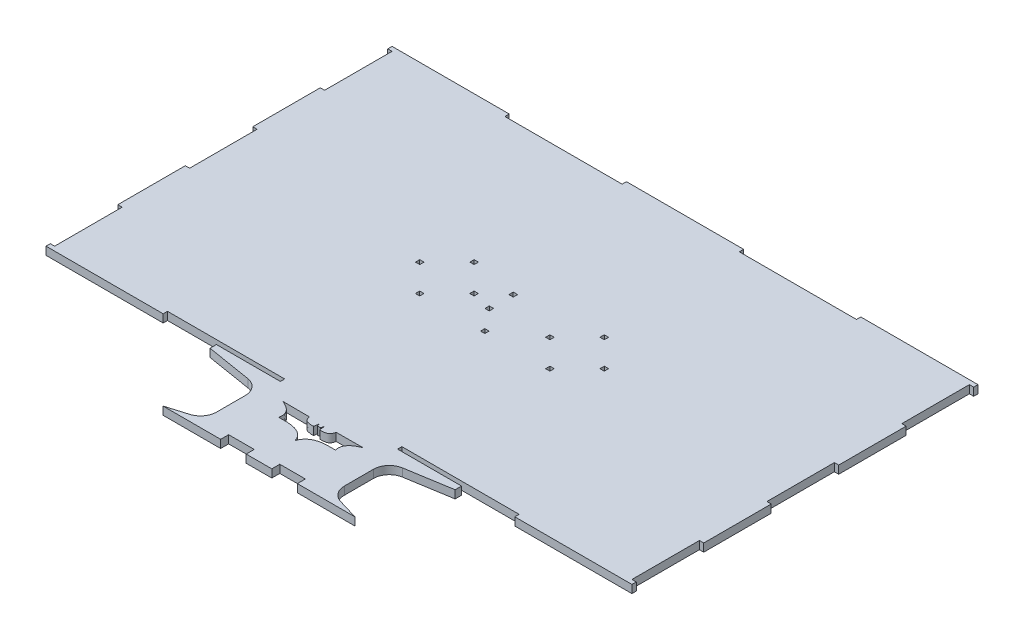
from build123d import *

# Parameters (mm, degrees)
SKETCH1_W           = 2.7
SKETCH1_H           = 2.7
BOSS_EXTRUDE1_DEPTH = 5


with BuildPart() as part:
    # Sketch1 → Boss-Extrude1 (new body)
    with BuildSketch(Plane(origin=(0, 0, 0), x_dir=(1, 0, 0), z_dir=(0, 1, 0))):
        with BuildLine():
            Line((-183.2, 108.2), (-109.92, 108.2))
            Line((-109.92, 108.2), (-109.92, 105.5))
            Line((-109.92, 105.5), (-36.64, 105.5))
            Line((-36.64, 105.5), (-36.64, 108.2))
            Line((-36.64, 108.2), (36.64, 108.2))
            Line((36.64, 108.2), (36.64, 105.5))
            Line((36.64, 105.5), (109.92, 105.5))
            Line((109.92, 105.5), (109.92, 108.2))
            Line((109.92, 108.2), (183.2, 108.2))
            Line((183.2, 108.2), (183.2, 105.5))
            Line((183.2, 105.5), (180.5, 105.5))
            Line((180.5, 105.5), (180.5, 63.3))
            Line((180.5, 63.3), (183.2, 63.3))
            Line((183.2, 63.3), (183.2, 21.1))
            Line((183.2, 21.1), (180.5, 21.1))
            Line((180.5, 21.1), (180.5, -21.1))
            Line((180.5, -21.1), (183.2, -21.1))
            Line((183.2, -21.1), (183.2, -63.3))
            Line((183.2, -63.3), (180.5, -63.3))
            Line((180.5, -63.3), (180.5, -105.5))
            Line((180.5, -105.5), (183.2, -105.5))
            Line((183.2, -105.5), (183.2, -108.2))
            Line((183.2, -108.2), (109.92, -108.2))
            Line((109.92, -108.2), (109.92, -105.5))
            Line((109.92, -105.5), (36.64, -105.5))
            Line((36.64, -105.5), (36.64, -108.2))
            Line((36.64, -108.2), (76.64, -108.2))
            Line((76.64, -108.2), (76.64, -112.2))
            Line((76.64, -112.2), (48.383969685, -116.8270792))
            ThreePointArc((48.383969685, -116.8270792), (42.378966502, -120.22108374), (40, -126.695637657))
            Line((40, -126.695637657), (40, -144.759693491))
            ThreePointArc((40, -144.759693491), (41.977070717, -150.728998787), (47.126521144, -154.337956343))
            Line((47.126521144, -154.337956343), (60, -158.2))
            Line((60, -158.2), (40, -158.2))
            Line((40, -158.2), (24, -158.2))
            Line((24, -158.2), (24, -153.2))
            Line((24, -153.2), (8, -153.2))
            Line((8, -153.2), (8, -158.2))
            Line((8, -158.2), (-8, -158.2))
            Line((-8, -158.2), (-8, -153.2))
            Line((-8, -153.2), (-24, -153.2))
            Line((-24, -153.2), (-24, -158.2))
            Line((-24, -158.2), (-40, -158.2))
            Line((-40, -158.2), (-60, -158.2))
            Line((-60, -158.2), (-47.126521144, -154.337956343))
            ThreePointArc((-47.126521144, -154.337956343), (-41.977070717, -150.728998787), (-40, -144.759693491))
            Line((-40, -144.759693491), (-40, -126.695637657))
            ThreePointArc((-40, -126.695637657), (-42.378966502, -120.22108374), (-48.383969685, -116.8270792))
            Line((-48.383969685, -116.8270792), (-76.64, -112.2))
            Line((-76.64, -112.2), (-76.64, -108.2))
            Line((-76.64, -108.2), (-36.64, -108.2))
            Line((-36.64, -108.2), (-36.64, -105.5))
            Line((-36.64, -105.5), (-109.92, -105.5))
            Line((-109.92, -105.5), (-109.92, -108.2))
            Line((-109.92, -108.2), (-183.2, -108.2))
            Line((-183.2, -108.2), (-183.2, -105.5))
            Line((-183.2, -105.5), (-180.5, -105.5))
            Line((-180.5, -105.5), (-180.5, -63.3))
            Line((-180.5, -63.3), (-183.2, -63.3))
            Line((-183.2, -63.3), (-183.2, -21.1))
            Line((-183.2, -21.1), (-180.5, -21.1))
            Line((-180.5, -21.1), (-180.5, 21.1))
            Line((-180.5, 21.1), (-183.2, 21.1))
            Line((-183.2, 21.1), (-183.2, 63.3))
            Line((-183.2, 63.3), (-180.5, 63.3))
            Line((-180.5, 63.3), (-180.5, 105.5))
            Line((-180.5, 105.5), (-183.2, 105.5))
            Line((-183.2, 105.5), (-183.2, 108.2))
        make_face()
        with BuildLine():
            Line((0.9301176, -120.716600974), (0, -120.68082722))
            Line((0, -120.68082722), (-0.9301176, -120.716600974))
            Line((-0.9301176, -120.716600974), (-1.4468496, -118.933875574))
            Line((-1.4468496, -118.933875574), (-1.505337966, -118.732090711))
            Line((-1.505337966, -118.732090711), (-1.5243594, -118.908038974))
            add(Edge.make_bspline(
                [(-2.0927646, -122.111777374), (-2.0066426, -121.999818774), (-1.859073837, -121.914980184), (-1.8343986, -121.775901574), (-1.666428749, -120.829162413), (-1.6277058, -119.863993174), (-1.5243594, -118.908038974)],
                knots=[0, 0, 0, 0, 1, 1, 1, 2, 2, 2, 2], degree=3))
            add(Edge.make_bspline(
                [(-8.3452218, -118.287960574), (-8.1729778, -118.856365774), (-8.075779611, -119.453175974), (-7.8284898, -119.993176174), (-7.648412968, -120.386405174), (-7.396003023, -120.758010223), (-7.0792284, -121.052476774), (-6.770919603, -121.339073684), (-6.396966748, -121.576394249), (-5.9940912, -121.698391774), (-5.156587311, -121.952002107), (-4.280620327, -122.071245104), (-3.4104312, -122.163450574), (-2.973318406, -122.209767162), (-2.5319868, -122.129001774), (-2.0927646, -122.111777374)],
                knots=[0, 0, 0, 0, 1, 1, 1, 2, 2, 2, 3, 3, 3, 4, 4, 4, 5, 5, 5, 5], degree=3))
            Line((-8.3452218, -118.287960574), (-25.0098288, -118.210450774))
            add(Edge.make_bspline(
                [(-17.7239076, -128.157541774), (-17.6463978, -127.503014574), (-17.486801223, -126.8530449), (-17.4913782, -126.193960174), (-17.495488714, -125.602046218), (-17.572706856, -125.001904806), (-17.7497442, -124.437071374), (-17.938674268, -123.834294492), (-18.223243755, -123.255529036), (-18.5765154, -122.731855774), (-18.962093872, -122.160292392), (-19.432781213, -121.642214377), (-19.9458552, -121.181659774), (-20.53296266, -120.654649929), (-21.178318096, -120.187467606), (-21.8577636, -119.786483374), (-22.869428608, -119.189435173), (-23.975534695, -118.767378369), (-25.0098288, -118.210450774)],
                knots=[0, 0, 0, 0, 1, 1, 1, 2, 2, 2, 3, 3, 3, 4, 4, 4, 5, 5, 5, 6, 6, 6, 6], degree=3))
            add(Edge.make_bspline(
                [(0, -135.727665574), (-0.258366, -135.081750574), (-0.446586906, -134.403141283), (-0.775098, -133.789920574), (-1.096611928, -133.189761242), (-1.489704454, -132.623203353), (-1.937745, -132.110541574), (-2.391023881, -131.591885932), (-2.905578598, -131.121252413), (-3.4621044, -130.715365174), (-4.057630696, -130.281033966), (-4.699347279, -129.901244204), (-5.3740128, -129.604391374), (-6.21408481, -129.23475969), (-7.091056719, -128.940135618), (-7.9835094, -128.725946974), (-9.035354612, -128.473504123), (-10.109700417, -128.304069497), (-11.1872478, -128.209214974), (-12.58604985, -128.086080991), (-13.995132408, -128.060594987), (-15.3986136, -128.105868574), (-16.173499897, -128.130864906), (-16.9488096, -128.140317374), (-17.7239076, -128.157541774)],
                knots=[0, 0, 0, 0, 1, 1, 1, 2, 2, 2, 3, 3, 3, 4, 4, 4, 5, 5, 5, 6, 6, 6, 7, 7, 7, 8, 8, 8, 8], degree=3))
            add(Edge.make_bspline(
                [(0, -135.727665574), (0.258366, -135.081750574), (0.446586906, -134.403141283), (0.775098, -133.789920574), (1.096611928, -133.189761242), (1.489704454, -132.623203353), (1.937745, -132.110541574), (2.391023881, -131.591885932), (2.905578598, -131.121252413), (3.4621044, -130.715365174), (4.057630696, -130.281033966), (4.699347279, -129.901244204), (5.3740128, -129.604391374), (6.21408481, -129.23475969), (7.091056719, -128.940135618), (7.9835094, -128.725946974), (9.035354612, -128.473504123), (10.109700417, -128.304069497), (11.1872478, -128.209214974), (12.58604985, -128.086080991), (13.995132408, -128.060594987), (15.3986136, -128.105868574), (16.173499897, -128.130864906), (16.9488096, -128.140317374), (17.7239076, -128.157541774)],
                knots=[0, 0, 0, 0, 1, 1, 1, 2, 2, 2, 3, 3, 3, 4, 4, 4, 5, 5, 5, 6, 6, 6, 7, 7, 7, 8, 8, 8, 8], degree=3))
            add(Edge.make_bspline(
                [(17.7239076, -128.157541774), (17.6463978, -127.503014574), (17.486801223, -126.8530449), (17.4913782, -126.193960174), (17.495488714, -125.602046218), (17.572706856, -125.001904806), (17.7497442, -124.437071374), (17.938674268, -123.834294492), (18.223243755, -123.255529036), (18.5765154, -122.731855774), (18.962093872, -122.160292392), (19.432781213, -121.642214377), (19.9458552, -121.181659774), (20.53296266, -120.654649929), (21.178318096, -120.187467606), (21.8577636, -119.786483374), (22.869428608, -119.189435173), (23.975534695, -118.767378369), (25.0098288, -118.210450774)],
                knots=[0, 0, 0, 0, 1, 1, 1, 2, 2, 2, 3, 3, 3, 4, 4, 4, 5, 5, 5, 6, 6, 6, 6], degree=3))
            Line((25.0098288, -118.210450774), (8.3452218, -118.287960574))
            add(Edge.make_bspline(
                [(8.3452218, -118.287960574), (8.1729778, -118.856365774), (8.075779611, -119.453175974), (7.8284898, -119.993176174), (7.648412968, -120.386405174), (7.396003023, -120.758010223), (7.0792284, -121.052476774), (6.770919603, -121.339073684), (6.396966748, -121.576394249), (5.9940912, -121.698391774), (5.156587311, -121.952002107), (4.280620327, -122.071245104), (3.4104312, -122.163450574), (2.973318406, -122.209767162), (2.5319868, -122.129001774), (2.0927646, -122.111777374)],
                knots=[0, 0, 0, 0, 1, 1, 1, 2, 2, 2, 3, 3, 3, 4, 4, 4, 5, 5, 5, 5], degree=3))
            add(Edge.make_bspline(
                [(2.0927646, -122.111777374), (2.0066426, -121.999818774), (1.859073837, -121.914980184), (1.8343986, -121.775901574), (1.666428749, -120.829162413), (1.6277058, -119.863993174), (1.5243594, -118.908038974)],
                knots=[0, 0, 0, 0, 1, 1, 1, 2, 2, 2, 2], degree=3))
            Line((1.5243594, -118.908038974), (1.505337966, -118.732090711))
            Line((1.505337966, -118.732090711), (1.4468496, -118.933875574))
            Line((1.4468496, -118.933875574), (0.9301176, -120.716600974))
        make_face(mode=Mode.SUBTRACT)
        with Locations((57.703668038, 0)):
            Rectangle(SKETCH1_W, SKETCH1_H, mode=Mode.SUBTRACT)
        with Locations((40.703668038, 17)):
            Rectangle(SKETCH1_W, SKETCH1_H, mode=Mode.SUBTRACT)
        with Locations((40.703668038, -17)):
            Rectangle(SKETCH1_W, SKETCH1_H, mode=Mode.SUBTRACT)
        with Locations((23.703668038, 0)):
            Rectangle(SKETCH1_W, SKETCH1_H, mode=Mode.SUBTRACT)
        with Locations((-23.703668038, 0)):
            Rectangle(SKETCH1_W, SKETCH1_H, mode=Mode.SUBTRACT)
        with Locations((-40.703668038, -17)):
            Rectangle(SKETCH1_W, SKETCH1_H, mode=Mode.SUBTRACT)
        with Locations((-40.703668038, 17)):
            Rectangle(SKETCH1_W, SKETCH1_H, mode=Mode.SUBTRACT)
        with Locations((-57.703668038, 0)):
            Rectangle(SKETCH1_W, SKETCH1_H, mode=Mode.SUBTRACT)
        with Locations((-0.001918656, -16.996940674)):
            Rectangle(SKETCH1_W, SKETCH1_H, mode=Mode.SUBTRACT)
        with Locations((-10.874420173, 11.65292472)):
            Rectangle(SKETCH1_W, SKETCH1_H, mode=Mode.SUBTRACT)
        with Locations((-10.874420173, -3.34707528)):
            Rectangle(SKETCH1_W, SKETCH1_H, mode=Mode.SUBTRACT)
    extrude(amount=BOSS_EXTRUDE1_DEPTH)


solid = part.part
